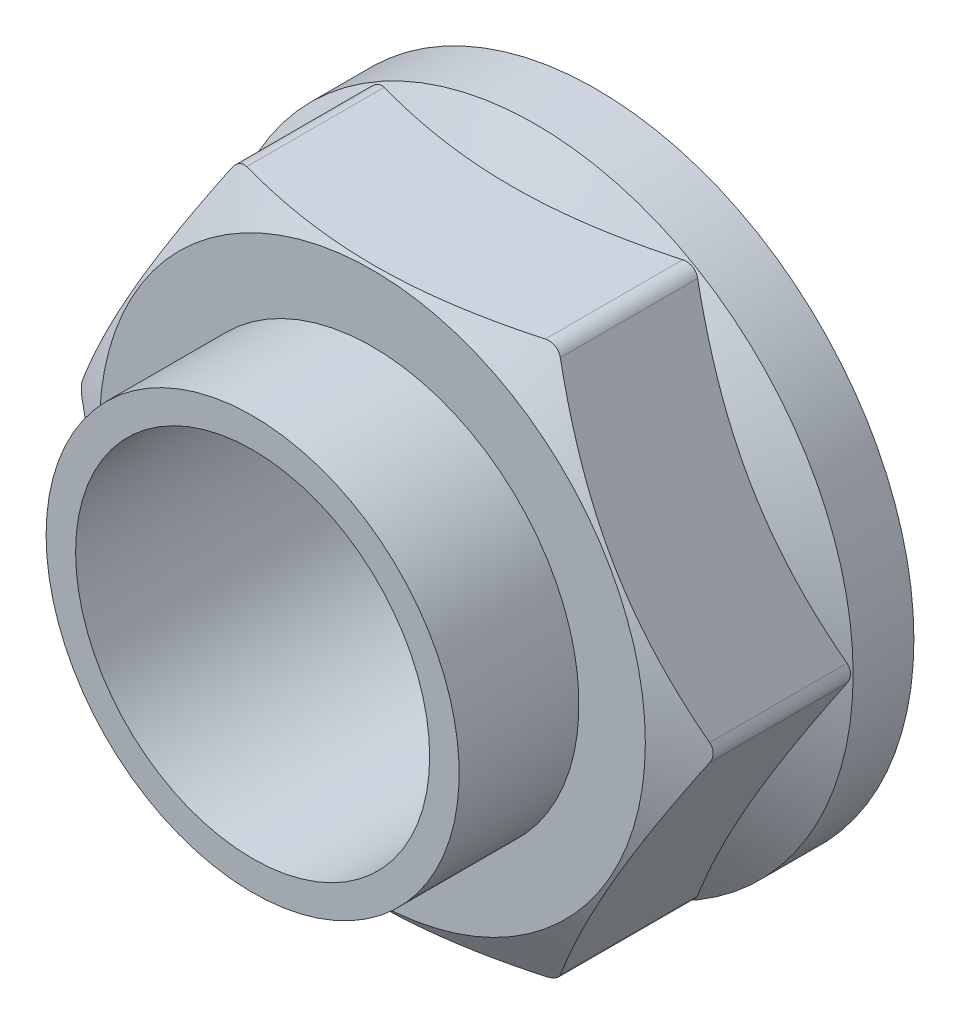
from build123d import *
from build123d.topology import SkipClean

# Parameters (mm, degrees)
SKETCH2_R           = 10.2
BOSS_EXTRUDE1_DEPTH = 12.9
SKETCH4_R           = 11.9
SKETCH4_R_2         = 10.2
BOSS_EXTRUDE2_DEPTH = 19.8


with BuildPart() as part:
    # Sketch1 → Revolve1 (revolve)
    with BuildSketch(Plane(origin=(0, 0, 0), x_dir=(0, 0, -1), z_dir=(1, 0, 0))):
        Polygon((0, 10.2), (0, 18.3), (-3.5, 18.3), (-8.17653718, 10.2), align=None)
    revolve(axis=Axis((0, 0, 27.758529938), (0, 0, -1)))

    # Sketch2 → Boss-Extrude1 (add)
    with SkipClean():  # the faces are left unmerged after this step: merging them gives an invalid solid
        with BuildSketch(Plane.XY):
            with BuildLine():
                Line((18.071063426, 0.5), (9.468544415, 15.4))
                ThreePointArc((9.468544415, 15.4), (9.102519011, 15.766025404), (8.602519011, 15.9))
                Line((8.602519011, 15.9), (-8.602519011, 15.9))
                ThreePointArc((-8.602519011, 15.9), (-9.102519011, 15.766025404), (-9.468544415, 15.4))
                Line((-9.468544415, 15.4), (-18.071063426, 0.5))
                ThreePointArc((-18.071063426, 0.5), (-18.205038022, 0), (-18.071063426, -0.5))
                Line((-18.071063426, -0.5), (-9.468544415, -15.4))
                ThreePointArc((-9.468544415, -15.4), (-9.102519011, -15.766025404), (-8.602519011, -15.9))
                Line((-8.602519011, -15.9), (8.602519011, -15.9))
                ThreePointArc((8.602519011, -15.9), (9.102519011, -15.766025404), (9.468544415, -15.4))
                Line((9.468544415, -15.4), (18.071063426, -0.5))
                ThreePointArc((18.071063426, -0.5), (18.205038022, 0), (18.071063426, 0.5))
            make_face()
            Circle(SKETCH2_R, mode=Mode.SUBTRACT)
        extrude(amount=BOSS_EXTRUDE1_DEPTH)

    # Sketch3 → Cut-Revolve2 (revolve, cut)
    with SkipClean():  # the faces are left unmerged after this step: merging them gives an invalid solid
        with BuildSketch(Plane(origin=(0, 0, 0), x_dir=(0, 0, -1), z_dir=(1, 0, 0))):
            Polygon((-11.414359354, 18.3), (-21.97986928, 0), (-22.588162692, 0), (-22.588162692, 18.3), align=None)
        revolve(axis=Axis((0, 0, 0), (0, 0, 1)), mode=Mode.SUBTRACT)

    # Sketch4 → Boss-Extrude2 (add)
    with SkipClean():  # the faces are left unmerged after this step: merging them gives an invalid solid
        with BuildSketch(Plane.XY):
            Circle(SKETCH4_R)
            Circle(SKETCH4_R_2, mode=Mode.SUBTRACT)
        extrude(amount=BOSS_EXTRUDE2_DEPTH)


solid = part.part
